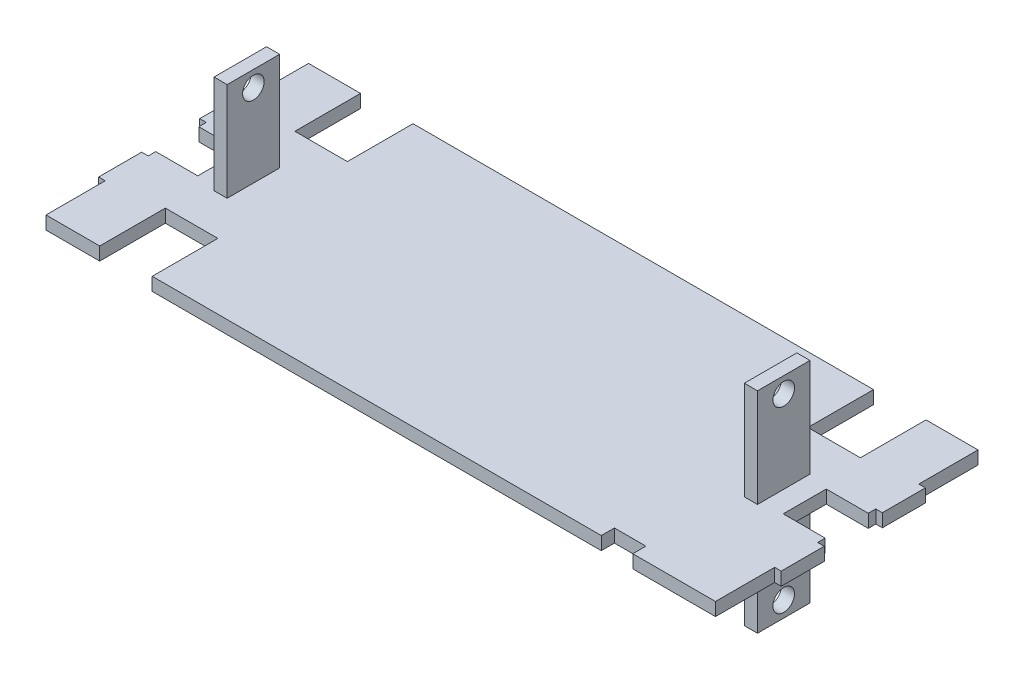
from build123d import *

# Parameters (mm, degrees)
BOSS_EXTRUDE1_DEPTH     = 3.175
SKETCH2_W               = 6.35
SKETCH2_H               = 25.4
BOSS_EXTRUDE2_DEPTH     = 50.8
CUT_EXTRUDE1_DEPTH      = 308.492808087
CUT_EXTRUDE1_DEPTH_BACK = 308.492808087
SKETCH3_R               = 5.207


with BuildPart() as part:
    # Sketch1 → Boss-Extrude1 (new, symmetric)
    with BuildSketch(Plane(origin=(0, 0, 0), x_dir=(1, 0, 0), z_dir=(0, 1, 0))):
        Polygon((161.925, -63.5), (121.92, -63.5), (121.92, -57.15), (106.68, -57.15), (106.68, -63.5), (-106.68, -63.5), (-110.5408, -63.5), (-110.5408, -31.75), (-135.9408, -31.75), (-135.9408, -63.5), (-161.925, -63.5), (-161.925, -34.874677354), (-165.1, -34.874677354), (-165.1, -14.046677354), (-161.925, -14.046677354), (-161.925, -10.414), (-141.605, -10.414), (-141.605, 10.414), (-161.925, 10.414), (-161.925, 14.046677354), (-165.1, 14.046677354), (-165.1, 34.874677354), (-161.925, 34.874677354), (-161.925, 63.5), (-136.779, 63.5), (-136.779, 31.75), (-111.379, 31.75), (-111.379, 63.5), (111.379, 63.5), (111.379, 31.75), (136.779, 31.75), (136.779, 63.5), (161.925, 63.5), (161.925, 34.874677354), (165.1, 34.874677354), (165.1, 14.046677354), (161.925, 14.046677354), (161.925, 10.414), (141.605, 10.414), (141.605, -10.414), (161.925, -10.414), (161.925, -14.046677354), (165.1, -14.046677354), (165.1, -34.874677354), (161.925, -34.874677354), align=None)
    extrude(amount=BOSS_EXTRUDE1_DEPTH, both=True)

    # Sketch2 → Boss-Extrude2 (add, symmetric)
    with BuildSketch(Plane(origin=(0, 0, 0), x_dir=(1, 0, 0), z_dir=(0, 1, 0))):
        with Locations((128.27, 0)):
            Rectangle(SKETCH2_W, SKETCH2_H)
        with Locations((-128.27, 0)):
            Rectangle(SKETCH2_W, SKETCH2_H)
    extrude(amount=BOSS_EXTRUDE2_DEPTH, both=True)

    # Sketch3 → Cut-Extrude1 (cut, two sides: drawn at the far end of the back side and taken through both)
    with BuildSketch(Plane.ZY.offset(131.445).offset(-CUT_EXTRUDE1_DEPTH_BACK)):
        with Locations((0, 43.18)):
            Circle(SKETCH3_R)
        with Locations((0, -43.18)):
            Circle(SKETCH3_R)
    extrude(amount=CUT_EXTRUDE1_DEPTH + CUT_EXTRUDE1_DEPTH_BACK, mode=Mode.SUBTRACT)


solid = part.part
